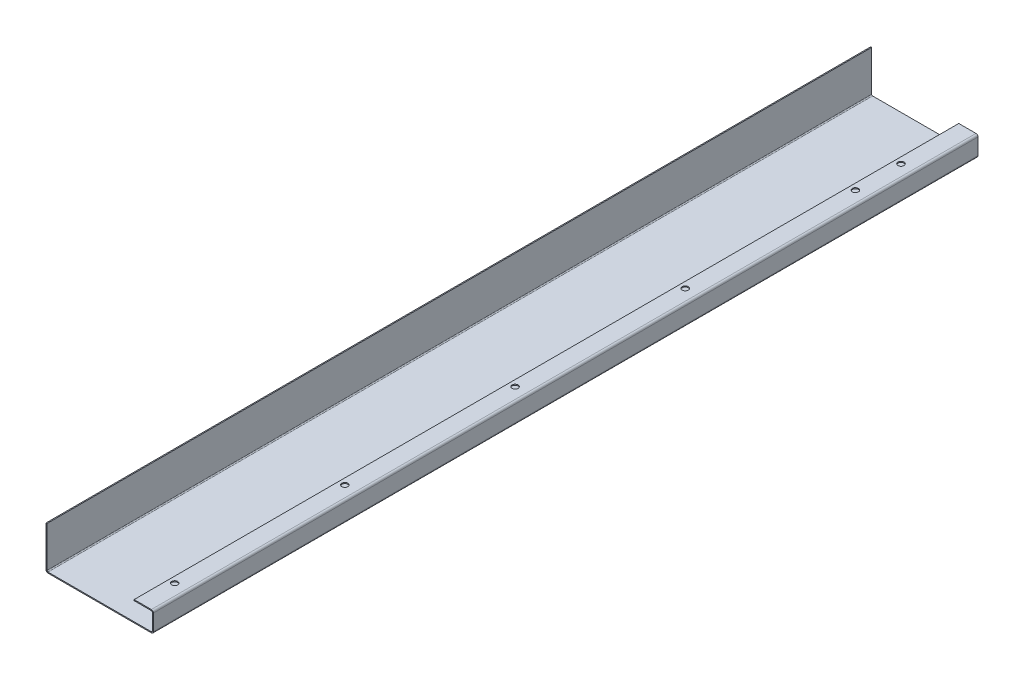
from build123d import *

# Parameters (mm, degrees)
SKETCH1_W                    = 106
SKETCH1_H                    = 814
BASE_FLANGE1_DEPTH           = 1
EDGE_FLANGE1_STRIP_W         = 6
EDGE_FLANGE1_STRIP_H         = 1
EDGE_FLANGE1_STRIP_CUT_DEPTH = 814
EDGE_FLANGE1_DEPTH           = 814
EDGE_FLANGE2_STRIP_W         = 6
EDGE_FLANGE2_STRIP_H         = 1
EDGE_FLANGE2_STRIP_CUT_DEPTH = 814
EDGE_FLANGE2_DEPTH           = 814
EDGE_FLANGE4_STRIP_W         = 6
EDGE_FLANGE4_STRIP_H         = 1
EDGE_FLANGE4_STRIP_CUT_DEPTH = 814
EDGE_FLANGE4_DEPTH           = 814
SKETCH19_R                   = 3
CUT_EXTRUDE2_DEPTH           = 10


# Sheet-metal steps are written as plain solids
with BuildPart() as part:
    # Sketch1 → Base-Flange1 (new body)
    with BuildSketch(Plane(origin=(0, 0, 0), x_dir=(1, 0, 0), z_dir=(0, 1, 0))):
        with Locations((53, 407)):
            Rectangle(SKETCH1_W, SKETCH1_H)
    extrude(amount=-BASE_FLANGE1_DEPTH)

    # Edge-Flange1 strip (across the edge) → Edge-Flange1 strip cut (cut)
    with BuildSketch(Plane(origin=(106, 0, 0), x_dir=(-1, 0, 0), z_dir=(0, 0, -1))):
        with Locations((-1, -0.5)):
            Rectangle(EDGE_FLANGE1_STRIP_W, EDGE_FLANGE1_STRIP_H)
    extrude(amount=EDGE_FLANGE1_STRIP_CUT_DEPTH, mode=Mode.SUBTRACT)

    # Edge-Flange1 section (across the edge) → Edge-Flange1 (add)
    with BuildSketch(Plane(origin=(106, 0, 0), x_dir=(-1, 0, 0), z_dir=(0, 0, -1))):
        with BuildLine():
            Line((0, 1), (0, 19))
            Line((0, 19), (1, 19))
            Line((1, 19), (1, 1))
            ThreePointArc((1, 1), (1.292893219, 0.292893219), (2, 0))
            Line((2, 0), (2, -1))
            ThreePointArc((2, -1), (0.585786438, -0.414213562), (0, 1))
        make_face()
    extrude(amount=EDGE_FLANGE1_DEPTH)

    # Edge-Flange2 strip (across the edge) → Edge-Flange2 strip cut (cut)
    with BuildSketch(Plane(origin=(105, 19, 0), x_dir=(0, -1, 0), z_dir=(0, 0, -1))):
        with Locations((-1, -0.5)):
            Rectangle(EDGE_FLANGE2_STRIP_W, EDGE_FLANGE2_STRIP_H)
    extrude(amount=EDGE_FLANGE2_STRIP_CUT_DEPTH, mode=Mode.SUBTRACT)

    # Edge-Flange2 section (across the edge) → Edge-Flange2 (add)
    with BuildSketch(Plane(origin=(105, 19, 0), x_dir=(0, -1, 0), z_dir=(0, 0, -1))):
        with BuildLine():
            Line((0, 1), (0, 18))
            Line((0, 18), (1, 18))
            Line((1, 18), (1, 1))
            ThreePointArc((1, 1), (1.292893219, 0.292893219), (2, 0))
            Line((2, 0), (2, -1))
            ThreePointArc((2, -1), (0.585786438, -0.414213562), (0, 1))
        make_face()
    extrude(amount=EDGE_FLANGE2_DEPTH)

    # Edge-Flange4 strip (across the edge) → Edge-Flange4 strip cut (cut)
    with BuildSketch(Plane.XY.offset(-814)):
        with Locations((-1, -0.5)):
            Rectangle(EDGE_FLANGE4_STRIP_W, EDGE_FLANGE4_STRIP_H)
    extrude(amount=EDGE_FLANGE4_STRIP_CUT_DEPTH, mode=Mode.SUBTRACT)

    # Edge-Flange4 section (across the edge) → Edge-Flange4 (add)
    with BuildSketch(Plane.XY.offset(-814)):
        with BuildLine():
            Line((0, 1), (0, 41))
            Line((0, 41), (1, 41))
            Line((1, 41), (1, 1))
            ThreePointArc((1, 1), (1.292893219, 0.292893219), (2, 0))
            Line((2, 0), (2, -1))
            ThreePointArc((2, -1), (0.585786438, -0.414213562), (0, 1))
        make_face()
    extrude(amount=EDGE_FLANGE4_DEPTH)

    # Sketch19 → Cut-Extrude2 (cut)
    with BuildSketch(Plane(origin=(0, 19, 0), x_dir=(1, 0, 0), z_dir=(0, 1, 0))):
        with Locations(Location((93, 751, 0), (0, 0, 180))):
            Circle(SKETCH19_R)
        with Locations(Location((93, 706, 0), (0, 0, 180))):
            Circle(SKETCH19_R)
        with Locations(Location((93, 538, 0), (0, 0, 180))):
            Circle(SKETCH19_R)
        with Locations(Location((93, 370, 0), (0, 0, 180))):
            Circle(SKETCH19_R)
        with Locations(Location((93, 202, 0), (0, 0, 180))):
            Circle(SKETCH19_R)
        with Locations(Location((93, 34, 0), (0, 0, 180))):
            Circle(SKETCH19_R)
    extrude(amount=-CUT_EXTRUDE2_DEPTH, mode=Mode.SUBTRACT)


solid = part.part
